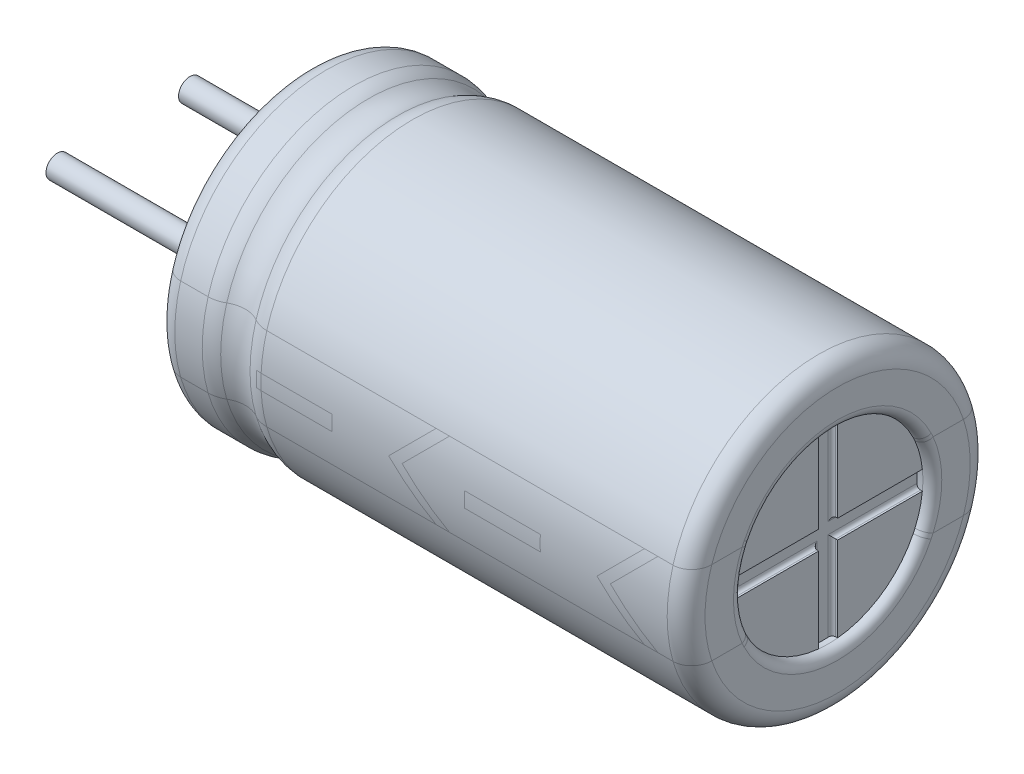
from build123d import *

# Parameters (mm, degrees)
FILLET_1_R          = 0.8
SKETCH_2_R          = 2.5
CUT_EXTRUDE_1_DEPTH = 0.25
FILLET_2_R          = 0.5
CUT_EXTRUDE_2_DEPTH = 0.15
FILLET_3_R          = 0.1
CUT_EXTRUDE_START   = -0.15
SKETCH_5_R          = 2.5
CUT_EXTRUDE_3_DEPTH = 0.15
SKETCH_6_R          = 0.3
EXTRUDE_2_DEPTH     = 5
FILLET_4_R          = 0.5
FILLET_6_R          = 0.2
FILLET_7_R          = 0.25


# Some blends are built 0.0001 mm under size
with BuildPart() as part:
    # Эскиз1 → Повернуть1 (revolve)
    with BuildSketch(Plane.XY, mode=Mode.PRIVATE) as revolve_1_sk:
        with BuildLine():
            Line((0, 0), (0, 4))
            Line((0, 4), (1.470849738, 4))
            ThreePointArc((1.470849738, 4), (2, 3.8), (2.529150262, 4))
            Line((2.529150262, 4), (14, 4))
            Line((14, 4), (14, 0))
            Line((14, 0), (0, 0))
        make_face()
    revolve(revolve_1_sk.sketch.rotate(Axis((-7.119144013, 0, 0), (1, 0, 0)), 90), axis=Axis((-7.119144013, 0, 0), (1, 0, 0)))

    # Скругление1
    fillet_1_edges = [part.edges().sort_by_distance(p)[0] for p in [
        (1.470849738, 0, -4),
        (2.529150262, 0, -4),
    ]]
    fillet(fillet_1_edges, radius=FILLET_1_R)

    # Эскиз2 → Вырез-Вытянуть1 (cut)
    with BuildSketch(Plane(origin=(14, 0, 0), x_dir=(0, 0, -1), z_dir=(1, 0, 0))):
        Circle(SKETCH_2_R)
    extrude(amount=-CUT_EXTRUDE_1_DEPTH, mode=Mode.SUBTRACT)

    # Скругление2
    fillet_2_edges = [part.edges().sort_by_distance(p)[0] for p in [
        (14, 0, -4),
    ]]
    fillet(fillet_2_edges, radius=FILLET_2_R)

    # Эскиз4 → Вырез-Вытянуть2 (cut)
    with BuildSketch(Plane(origin=(13.75, 0, 0), x_dir=(0, 0, -1), z_dir=(1, 0, 0))):
        with BuildLine():
            Line((-0.25, 2.487468593), (-0.25, 0.25))
            Line((-0.25, 0.25), (-2.487468593, 0.25))
            ThreePointArc((-2.487468593, 0.25), (-2.5, 0), (-2.487468593, -0.25))
            Line((-2.487468593, -0.25), (-0.25, -0.25))
            Line((-0.25, -0.25), (-0.25, -2.487468593))
            ThreePointArc((-0.25, -2.487468593), (0, -2.5), (0.25, -2.487468593))
            Line((0.25, -2.487468593), (0.25, -0.25))
            Line((0.25, -0.25), (2.487468593, -0.25))
            ThreePointArc((2.487468593, -0.25), (2.5, 0), (2.487468593, 0.25))
            Line((2.487468593, 0.25), (0.25, 0.25))
            Line((0.25, 0.25), (0.25, 2.487468593))
            ThreePointArc((0.25, 2.487468593), (0, 2.5), (-0.25, 2.487468593))
        make_face()
    extrude(amount=-CUT_EXTRUDE_2_DEPTH, mode=Mode.SUBTRACT)

    # Скругление3
    fillet_3_edges = [part.edges().sort_by_distance(p)[0] for p in [
        (13.6, 1.368734296, -0.25),
        (13.6, 0.25, -1.368734296),
        (13.6, -0.25, -1.368734296),
        (13.6, -1.368734296, -0.25),
        (13.6, -1.368734296, 0.25),
        (13.6, -0.25, 1.368734296),
        (13.6, 0.25, 1.368734296),
        (13.6, 1.368734296, 0.25),
    ]]
    fillet(fillet_3_edges, radius=FILLET_3_R)

    # Эскиз5 → Вырез-Вытянуть3 (cut)
    with BuildSketch(Plane.ZY.offset(CUT_EXTRUDE_START)):
        with Locations(Location((0, 0, 0), (0, 0, 180))):
            Circle(SKETCH_5_R)
    extrude(amount=CUT_EXTRUDE_3_DEPTH, mode=Mode.SUBTRACT)

    # Эскиз6 → Бобышка-Вытянуть2 (add)
    with BuildSketch(Plane.ZY.offset(-0.15)):
        with Locations((-1.75, 0)):
            Circle(SKETCH_6_R)
        with Locations(Location((1.75, 0, 0), (0, 0, 180))):
            Circle(SKETCH_6_R)
    extrude(amount=EXTRUDE_2_DEPTH)

    # Скругление4
    fillet_4_edges = [part.edges().sort_by_distance(p)[0] for p in [
        (0, 0, -4),
    ]]
    fillet(fillet_4_edges, radius=FILLET_4_R)

    # Скругление6
    # the kernel refuses this fillet: 0.2 mm, written as the material it takes off along each edge
    with BuildSketch(Plane(origin=(0, 0, 0), x_dir=(0, 0, -1), z_dir=(0, 1, 0))) as fillet_6_piece_1:
        with BuildLine():
            CenterArc((2.693649167, -0.2), FILLET_6_R, 90, 75.522487815)
            Line((2.5, -0.15), (2.496127017, -0.149))
            ThreePointArc((2.496127017, -0.149), (2.496, -0.075), (2.496, 0))
            Line((2.496, 0), (2.5, 0.004))
            Line((2.5, 0.004), (2.693649167, 0.004))
            Line((2.693649167, 0.004), (2.693649167, 0))
        make_face()
    revolve(axis=Axis((0, 0, 0), (-1, 0, 0)), mode=Mode.SUBTRACT)

    # Скругление7
    fillet_7_edges = [part.edges().sort_by_distance(p)[0] for p in [
        (14, 0, 2.5),
    ]]
    fillet(fillet_7_edges, radius=FILLET_7_R - 0.0001)  # a hair under: the kernel refuses the full size


solid = part.part
